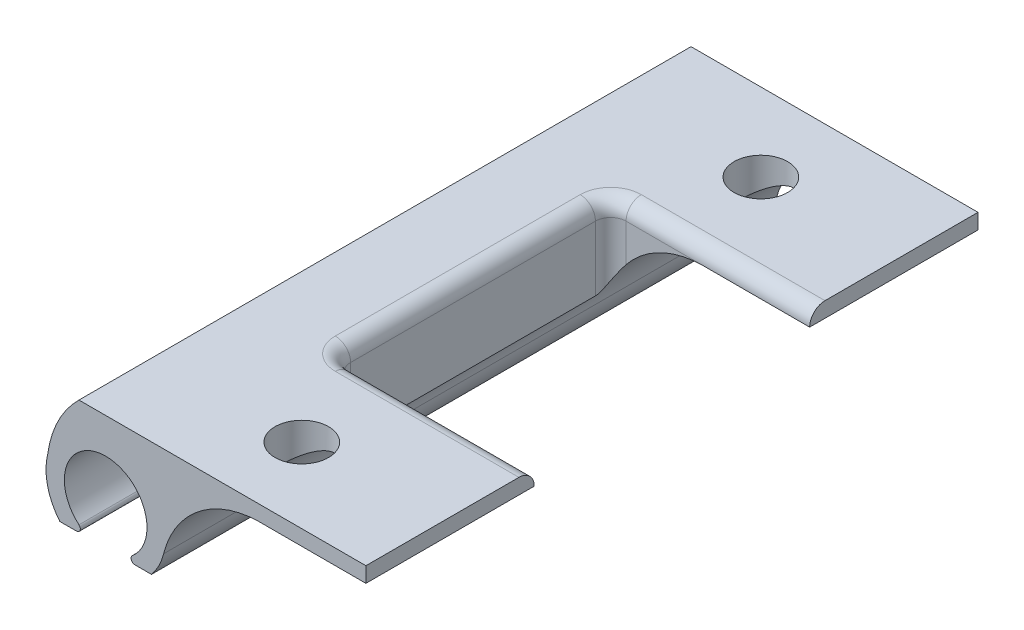
from build123d import *

# Parameters (mm, degrees)
EXTRUDE_1_DEPTH                            = 3.9
EXTRUDE_3_DEPTH                            = 20
EXTRUDE_5_DEPTH                            = 20
FILLET_1_R                                 = 0.25
FILLET_1_OF_MIRROR_2_R                     = 0.25
SKETCH_7_R                                 = 5.5
CUT_EXTRUDE_3_DEPTH                        = 69.146236458
MIRROR_3_AT_THE_SECOND_PLANE_COPY_1_SKET_R = 5.5
MIRROR_3_AT_THE_SECOND_PLANE_COPY_1_DEPTH  = 69.146236458
ESQUISSE1_W                                = 44.6
ESQUISSE1_H                                = 40
ENL_V_MAT_EXTRU_1_DEPTH                    = 1.54
ENL_V_MAT_EXTRU_2_DEPTH                    = 57.761068742
ESQUISSE3_W                                = 50
ESQUISSE3_H                                = 1.36
ENL_V_MAT_EXTRU_3_DEPTH                    = 64.372466761
ESQUISSE4_W                                = 27.815449133
ESQUISSE4_H                                = 40
ENL_V_MAT_EXTRU_4_DEPTH                    = 54.066651895
ESQUISSE5_R                                = 1.75
ENL_V_MAT_EXTRU_5_DEPTH                    = 54.198396436
ESQUISSE6_W                                = 13
ESQUISSE6_H                                = 18
ENL_V_MAT_EXTRU_6_DEPTH                    = 54.198396473
CONG_1_R                                   = 1
CONG_2_R                                   = 1


with BuildPart() as part:
    # Эскиз1 → Бобышка-Вытянуть1 (new body)
    with BuildSketch(Plane(origin=(0, 0, 0), x_dir=(1, 0, 0), z_dir=(0, 1, 0))):
        with BuildLine():
            ThreePointArc((-44.6, -23.2), (-43.428427125, -26.028427125), (-40.6, -27.2))
            Line((-40.6, -27.2), (40.6, -27.2))
            ThreePointArc((40.6, -27.2), (43.428427125, -26.028427125), (44.6, -23.2))
            Line((44.6, -23.2), (44.6, 23.2))
            ThreePointArc((44.6, 23.2), (43.428427125, 26.028427125), (40.6, 27.2))
            Line((40.6, 27.2), (33.6, 27.2))
            Line((33.6, 27.2), (-5.4, 27.2))
            Line((-5.4, 27.2), (-40.6, 27.2))
            ThreePointArc((-40.6, 27.2), (-43.428427125, 26.028427125), (-44.6, 23.2))
            Line((-44.6, 23.2), (-44.6, -23.2))
        make_face()
    extrude(amount=EXTRUDE_1_DEPTH)



with BuildPart() as body_2:
    # Эскиз3 → Бобышка-Вытянуть3 (new, symmetric)
    with BuildSketch(Plane.XY):
        with BuildLine():
            Line((-47.815262386, -6.499919999), (-45.841869662, -6.499919999))
            ThreePointArc((-45.841869662, -6.499919999), (-44.821869662, -1.3), (-43.801869662, -6.499919999))
            Line((-43.801869662, -6.499919999), (-41.828476938, -6.499919999))
            ThreePointArc((-41.828476938, -6.499919999), (-44.821869662, -0.1), (-47.815262386, -6.499919999))
        make_face()
    extrude_3 = extrude(amount=EXTRUDE_3_DEPTH, both=True)


with BuildPart() as part_1:
    add(part.part)

    add(body_2.part)  # Бобышка-Вытянуть5 merges body 2
    # Эскиз5 → Бобышка-Вытянуть5 (add, symmetric)
    with BuildSketch(Plane.XY):
        with BuildLine():
            ThreePointArc((-41.631827579, 2.999901942), (-46.932438451, 0.61464415), (-48.60377877, -4.952451312))
            Line((-48.60377877, -4.952451312), (-47.348297278, -4.952451312))
            ThreePointArc((-47.348297278, -4.952451312), (-44.821869662, -1.3), (-42.295442046, -4.952451312))
            Line((-42.295442046, -4.952451312), (-41.039960555, -4.952451312))
            ThreePointArc((-41.039960555, -4.952451312), (-38.684888017, -1.351535806), (-34.6, 0))
            Line((-34.6, 0), (-36.641600827, 0.870983001))
            ThreePointArc((-36.641600827, 0.870983001), (-38.922074934, 2.438561027), (-41.631827579, 2.999901942))
        make_face()
    extrude_5 = extrude(amount=EXTRUDE_5_DEPTH, both=True)

    # Скругление1
    fillet_1_edges = [part_1.edges().sort_by_distance(p)[0] for p in [
        (-43.801869662, -6.499919999, 0),
        (-45.841869662, -6.499919999, 0),
    ]]
    fillet(fillet_1_edges, radius=FILLET_1_R)

    # Зеркальное отражение1: Бобышка-Вытянуть5 across plane
    add(extrude_5.mirror(Plane(origin=(0, 0, 0), x_dir=(0, 0, 1), z_dir=(1, 0, 0))))

    # Зеркальное отражение2: Бобышка-Вытянуть3 across plane
    add(extrude_3.mirror(Plane(origin=(0, 0, 0), x_dir=(0, 0, 1), z_dir=(1, 0, 0))))

    # Скругление1 of Зеркальное отражение2
    fillet_1_of_mirror_2_edges = [part_1.edges().sort_by_distance(p)[0] for p in [
        (43.801869662, -6.499919999, 0),
        (45.841869662, -6.499919999, 0),
    ]]
    fillet(fillet_1_of_mirror_2_edges, radius=FILLET_1_OF_MIRROR_2_R)

    # Эскиз7 → Вырез-Вытянуть3 (cut, through all)
    with BuildSketch(Plane.XY.offset(20)):
        with Locations((-45, -4)):
            Circle(SKETCH_7_R)
    cut_extrude_3 = extrude(amount=CUT_EXTRUDE_3_DEPTH, mode=Mode.SUBTRACT)

    # Зеркальное отражение3: Вырез-Вытянуть3 across plane
    add(cut_extrude_3.mirror(Plane(origin=(0, 0, 0), x_dir=(0, 0, 1), z_dir=(1, 0, 0))), mode=Mode.SUBTRACT)

    # Зеркальное отражение3 at the second plane: Вырез-Вытянуть3 across plane
    add(cut_extrude_3.mirror(Plane.XY), mode=Mode.SUBTRACT)

    # Зеркальное отражение3 at the second plane copy 1 sket → Зеркальное отражение3 at the second plane copy 1 (cut, through all)
    with BuildSketch(Plane(origin=(0, 0, -20), x_dir=(-1, 0, 0), z_dir=(0, 0, -1))):
        with Locations((-45, -4)):
            Circle(MIRROR_3_AT_THE_SECOND_PLANE_COPY_1_SKET_R)
    extrude(amount=MIRROR_3_AT_THE_SECOND_PLANE_COPY_1_DEPTH, mode=Mode.SUBTRACT)

    # Esquisse1 → Enlèv. mat.-Extru.1 (cut)
    with BuildSketch(Plane(origin=(0, 3.9, 0), x_dir=(1, 0, 0), z_dir=(0, 1, 0))):
        with Locations((-22.3, 0)):
            Rectangle(ESQUISSE1_W, ESQUISSE1_H)
    extrude(amount=-ENL_V_MAT_EXTRU_1_DEPTH, mode=Mode.SUBTRACT)

    # Esquisse2 → Enlèv. mat.-Extru.2 (cut, through all)
    with BuildSketch(Plane(origin=(0, 3.9, 0), x_dir=(1, 0, 0), z_dir=(0, 1, 0))):
        Polygon((-44.6, 20), (-44.6, 27.2), (51.6, 27.2), (51.6, -27.2), (-44.6, -27.2), (-44.6, -20), (0, -20), (0, 20), align=None)
    extrude(amount=-ENL_V_MAT_EXTRU_2_DEPTH, mode=Mode.SUBTRACT)

    # Esquisse3 → Enlèv. mat.-Extru.3 (cut, through all)
    with BuildSketch(Plane.XY.offset(20)):
        with Locations((-25, 1.68)):
            Rectangle(ESQUISSE3_W, ESQUISSE3_H)
    extrude(amount=-ENL_V_MAT_EXTRU_3_DEPTH, mode=Mode.SUBTRACT)

    # Esquisse4 → Enlèv. mat.-Extru.4 (cut, through all)
    with BuildSketch(Plane.XZ):
        with Locations((-13.907724567, 0)):
            Rectangle(ESQUISSE4_W, ESQUISSE4_H)
    extrude(amount=-ENL_V_MAT_EXTRU_4_DEPTH, mode=Mode.SUBTRACT)

    # Esquisse5 → Enlèv. mat.-Extru.5 (cut, through all)
    with BuildSketch(Plane(origin=(0, 1, 0), x_dir=(1, 0, 0), z_dir=(0, 1, 0))):
        with Locations((-36.905449133, 14.9)):
            Circle(ESQUISSE5_R)
        with Locations((-36.905449133, -15.1)):
            Circle(ESQUISSE5_R)
    extrude(amount=-ENL_V_MAT_EXTRU_5_DEPTH, mode=Mode.SUBTRACT)

    # Esquisse6 → Enlèv. mat.-Extru.6 (cut, through all)
    with BuildSketch(Plane(origin=(0, 1, 0), x_dir=(1, 0, 0), z_dir=(0, 1, 0))):
        with Locations((-34.315449133, 0)):
            Rectangle(ESQUISSE6_W, ESQUISSE6_H)
    extrude(amount=-ENL_V_MAT_EXTRU_6_DEPTH, mode=Mode.SUBTRACT)

    # Congé1
    cong_1_edges = [part_1.edges().sort_by_distance(p)[0] for p in [
        (-40.815449133, -1.614859029, -9),
        (-40.815449133, -1.614859029, 9),
    ]]
    fillet(cong_1_edges, radius=CONG_1_R)

    # Congé2
    cong_2_edges = [part_1.edges().sort_by_distance(p)[0] for p in [
        (-33.815449133, 1, -9),
        (-40.522555914, 1, -8.707106781),
        (-33.815449133, 1, 9),
        (-40.522555914, 1, 8.707106781),
        (-40.815449133, 1, 0),
    ]]
    fillet(cong_2_edges, radius=CONG_2_R)


solid = part_1.part
